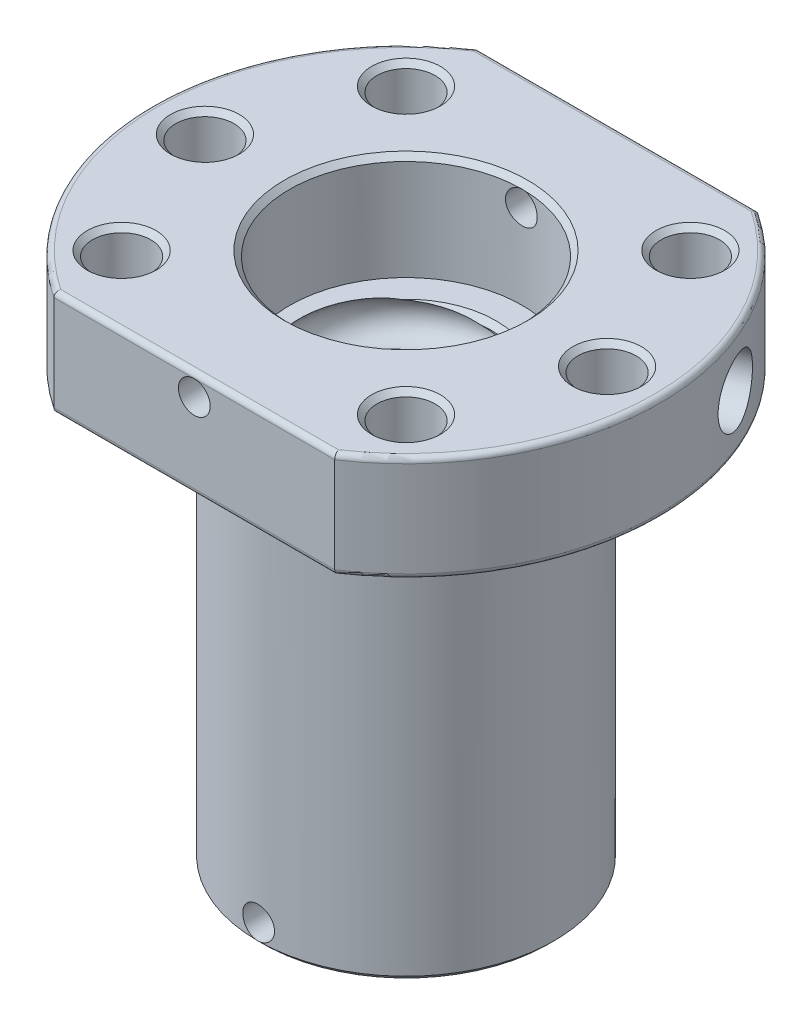
from build123d import *

# Parameters (mm, degrees)
CUT_EXTRUDE2_REACH      = 62.432
CUT_EXTRUDE3_REACH      = 60.958
SKETCH4_R               = 2.75
CHAMFER1_SIZE           = 0.5
CUT_EXTRUDE4_REACH      = 76.052
CUT_EXTRUDE4_END_RADIUS = 11
SKETCH5_R               = 2.5
SKETCH6_R               = 3
CUT_EXTRUDE5_DEPTH      = 10
FILLET1_R               = 0.5
SKETCH7_R               = 1.5
CUT_EXTRUDE6_DEPTH      = 69.381284083
SKETCH8_R               = 1.5
CUT_EXTRUDE7_DEPTH      = 28
CUT_SWEEP1_PITCH        = 5


with BuildPart() as part:
    # Sketch1 → Revolve1 (revolve)
    with BuildSketch(Plane(origin=(0, 0, 0), x_dir=(0, 0, -1), z_dir=(1, 0, 0))):
        Polygon((-11, 0), (-24, 0), (-24, -10), (-14, -10), (-14, -50), (-11, -50), (-11, -40), (-8, -40), (-8, -10), (-11, -10), align=None)
    revolve(axis=Axis((0, 0, 0), (0, -1, 0)))

    # Sketch2 → Cut-Extrude2 (cut, up to next)
    with BuildSketch(Plane(origin=(0, 0, 0), x_dir=(1, 0, 0), z_dir=(0, 1, 0)), mode=Mode.PRIVATE) as cut_extrude2_sk1:
        with BuildLine():
            Line((-13.266499161, 20), (13.266499161, 20))
            ThreePointArc((13.266499161, 20), (0, 24), (-13.266499161, 20))
        make_face()
    cut_extrude2_tool1 = extrude(cut_extrude2_sk1.sketch, amount=-CUT_EXTRUDE2_REACH, mode=Mode.PRIVATE) & part.part
    # Sketch2 → Cut-Extrude2 (cut, up to next)
    with BuildSketch(Plane(origin=(0, 0, 0), x_dir=(1, 0, 0), z_dir=(0, 1, 0)), mode=Mode.PRIVATE) as cut_extrude2_sk2:
        with BuildLine():
            Line((-13.266499161, -20), (13.266499161, -20))
            ThreePointArc((13.266499161, -20), (0, -24), (-13.266499161, -20))
        make_face()
    cut_extrude2_tool2 = extrude(cut_extrude2_sk2.sketch, amount=-CUT_EXTRUDE2_REACH, mode=Mode.PRIVATE) & part.part
    add(cut_extrude2_tool1.solids().sort_by_distance((0, 0, -21.612009))[0], mode=Mode.SUBTRACT)
    add(cut_extrude2_tool2.solids().sort_by_distance((0, 0, 21.612009))[0], mode=Mode.SUBTRACT)

    # Sketch4 → Cut-Extrude3 (cut, up to next)
    with BuildSketch(Plane(origin=(0, 0, 0), x_dir=(1, 0, 0), z_dir=(0, 1, 0)), mode=Mode.PRIVATE) as cut_extrude3_sk1:
        with Locations(Location((-19, 0, 0), (0, 0, 270))):
            Circle(SKETCH4_R)
    cut_extrude3_tool1 = extrude(cut_extrude3_sk1.sketch, amount=-CUT_EXTRUDE3_REACH, mode=Mode.PRIVATE) & part.part
    # Sketch4 → Cut-Extrude3 (cut, up to next)
    with BuildSketch(Plane(origin=(0, 0, 0), x_dir=(1, 0, 0), z_dir=(0, 1, 0)), mode=Mode.PRIVATE) as cut_extrude3_sk2:
        with Locations(Location((-13.435028843, -13.435028843, 0), (0, 0, 270))):
            Circle(SKETCH4_R)
    cut_extrude3_tool2 = extrude(cut_extrude3_sk2.sketch, amount=-CUT_EXTRUDE3_REACH, mode=Mode.PRIVATE) & part.part
    # Sketch4 → Cut-Extrude3 (cut, up to next)
    with BuildSketch(Plane(origin=(0, 0, 0), x_dir=(1, 0, 0), z_dir=(0, 1, 0)), mode=Mode.PRIVATE) as cut_extrude3_sk3:
        with Locations(Location((-13.435028843, 13.435028843, 0), (0, 0, 90))):
            Circle(SKETCH4_R)
    cut_extrude3_tool3 = extrude(cut_extrude3_sk3.sketch, amount=-CUT_EXTRUDE3_REACH, mode=Mode.PRIVATE) & part.part
    # Sketch4 → Cut-Extrude3 (cut, up to next)
    with BuildSketch(Plane(origin=(0, 0, 0), x_dir=(1, 0, 0), z_dir=(0, 1, 0)), mode=Mode.PRIVATE) as cut_extrude3_sk4:
        with Locations(Location((13.435028843, -13.435028843, 0), (0, 0, 90))):
            Circle(SKETCH4_R)
    cut_extrude3_tool4 = extrude(cut_extrude3_sk4.sketch, amount=-CUT_EXTRUDE3_REACH, mode=Mode.PRIVATE) & part.part
    # Sketch4 → Cut-Extrude3 (cut, up to next)
    with BuildSketch(Plane(origin=(0, 0, 0), x_dir=(1, 0, 0), z_dir=(0, 1, 0)), mode=Mode.PRIVATE) as cut_extrude3_sk5:
        with Locations(Location((19, 0, 0), (0, 0, 90))):
            Circle(SKETCH4_R)
    cut_extrude3_tool5 = extrude(cut_extrude3_sk5.sketch, amount=-CUT_EXTRUDE3_REACH, mode=Mode.PRIVATE) & part.part
    # Sketch4 → Cut-Extrude3 (cut, up to next)
    with BuildSketch(Plane(origin=(0, 0, 0), x_dir=(1, 0, 0), z_dir=(0, 1, 0)), mode=Mode.PRIVATE) as cut_extrude3_sk6:
        with Locations(Location((13.435028843, 13.435028843, 0), (0, 0, 270))):
            Circle(SKETCH4_R)
    cut_extrude3_tool6 = extrude(cut_extrude3_sk6.sketch, amount=-CUT_EXTRUDE3_REACH, mode=Mode.PRIVATE) & part.part
    add(cut_extrude3_tool1.solids().sort_by_distance((-19, 0, 0))[0], mode=Mode.SUBTRACT)
    add(cut_extrude3_tool2.solids().sort_by_distance((-13.435029, 0, 13.435029))[0], mode=Mode.SUBTRACT)
    add(cut_extrude3_tool3.solids().sort_by_distance((-13.435029, 0, -13.435029))[0], mode=Mode.SUBTRACT)
    add(cut_extrude3_tool4.solids().sort_by_distance((13.435029, 0, 13.435029))[0], mode=Mode.SUBTRACT)
    add(cut_extrude3_tool5.solids().sort_by_distance((19, 0, 0))[0], mode=Mode.SUBTRACT)
    add(cut_extrude3_tool6.solids().sort_by_distance((13.435029, 0, -13.435029))[0], mode=Mode.SUBTRACT)

    # Chamfer1
    chamfer1_edges = [part.edges().sort_by_distance(p)[0] for p in [
        (0, -50, -14),
        (-19, -10, -2.75),
        (-19, 0, -2.75),
        (-13.435028843, -10, 10.685028843),
        (-13.435028843, 0, 10.685028843),
        (-13.435028843, -10, -10.685028843),
        (-13.435028843, 0, -10.685028843),
        (13.435028843, -10, 16.185028843),
        (13.435028843, 0, 16.185028843),
        (19, -10, 2.75),
        (19, 0, 2.75),
        (13.435028843, -10, -16.185028843),
        (13.435028843, 0, -16.185028843),
        (0, 0, -11),
        (0, -10, -8),
        (0, -40, -8),
        (0, -50, -11),
    ]]
    chamfer(chamfer1_edges, length=CHAMFER1_SIZE)

    # Cut-Extrude4: up to this cylinder (the profile starts outside it)
    cut_extrude4_end = Plane(origin=(0, -5.000195, 0), z_dir=(0, 1, 0)) * Cylinder(CUT_EXTRUDE4_END_RADIUS, 175.104, mode=Mode.PRIVATE)
    # Sketch5 → Cut-Extrude4 (cut, up to the surface)
    with BuildSketch(Plane(origin=(22.17310878, 0, -9.184402377), x_dir=(-0.38268343236508734, 0, -0.9238795325112877), z_dir=(0.9238795325112877, 0, -0.38268343236508734)), mode=Mode.PRIVATE) as cut_extrude4_sk1:
        with Locations((0, -5.000195071)):
            Circle(SKETCH5_R)
    cut_extrude4_tool1 = extrude(cut_extrude4_sk1.sketch, amount=-CUT_EXTRUDE4_REACH, mode=Mode.PRIVATE) - cut_extrude4_end
    add(cut_extrude4_tool1.solids().sort_by_distance((22.173109, -5.000195, -9.184402))[0], mode=Mode.SUBTRACT)

    # Sketch6 → Cut-Extrude5 (cut)
    with BuildSketch(Plane(origin=(22.17310878, 0, -9.184402377), x_dir=(-0.38268343236508734, 0, -0.9238795325112877), z_dir=(0.9238795325112877, 0, -0.38268343236508734))):
        with Locations((0, -5.000195071)):
            Circle(SKETCH6_R)
    extrude(amount=-CUT_EXTRUDE5_DEPTH, mode=Mode.SUBTRACT)

    # Fillet1
    fillet1_edges = [part.edges().sort_by_distance(p)[0] for p in [
        (0, -10, -14),
        (24, -10, 0),
        (0, -10, 20),
        (0, 0, 20),
        (-24, 0, 0),
        (-24, -10, 0),
        (0, -10, -20),
        (0, 0, -20),
        (24, 0, 0),
    ]]
    fillet(fillet1_edges, radius=FILLET1_R)

    # Sketch7 → Cut-Extrude6 (cut, through all)
    with BuildSketch(Plane.XY.offset(20)):
        with Locations(Location((0, -2, 0), (0, 0, 90))):
            Circle(SKETCH7_R)
    extrude(amount=-CUT_EXTRUDE6_DEPTH, mode=Mode.SUBTRACT)

    # Sketch8 → Cut-Extrude7 (cut)
    with BuildSketch(Plane.XY.offset(14)):
        with Locations(Location((0, -48, 0), (0, 0, 270))):
            Circle(SKETCH8_R)
    extrude(amount=-CUT_EXTRUDE7_DEPTH, mode=Mode.SUBTRACT)

    # Cut-Sweep1: the profile of Sketch10 screwed along a right-hand helix of 10 turns, 12 arcs to a turn; built about Z, then put on its axis
    cut_sweep1_z = Axis((0, 0, 0), (0, 0, 1))
    cut_sweep1_corners = [(6.1, 0, 0), (8, 0, -1.9), (9.9, 0, 0), (8, 0, 1.9)]
    with BuildLine(mode=Mode.PRIVATE) as cut_sweep1_profile:
        ThreePointArc((6.1, 0, 0), (6.656497116, 0, -1.343502884), (8, 0, -1.9))
        ThreePointArc((8, 0, -1.9), (9.343502884, 0, -1.343502884), (9.9, 0, 0))
        ThreePointArc((9.9, 0, 0), (9.343502884, 0, 1.343502884), (8, 0, 1.9))
        ThreePointArc((8, 0, 1.9), (6.656497116, 0, 1.343502884), (6.1, 0, 0))
    cut_sweep1_cap = Face(cut_sweep1_profile.wire())
    cut_sweep1_arcs = [((6.1, 0, 0), (6.1, 0, -1.9), (8, 0, -1.9), (1, 0.7071067811865476, 1)), ((8, 0, -1.9), (9.9, 0, -1.9), (9.9, 0, 0), (1, 0.7071067811865476, 1)), ((9.9, 0, 0), (9.9, 0, 1.9), (8, 0, 1.9), (1, 0.7071067811865476, 1)), ((8, 0, 1.9), (6.1, 0, 1.9), (6.1, 0, 0), (1, 0.7071067811865476, 1))]  # start, shoulder, end, weights
    cut_sweep1_turn_angles = [0, 15, 30, 45, 60, 75, 90, 105, 120, 135, 150, 165, 180, 195, 210, 225, 240, 255, 270, 285, 300, 315, 330, 345, 360]
    cut_sweep1_turn_weights = [1, 0.9659258262890683, 1, 0.9659258262890683, 1, 0.9659258262890683, 1, 0.9659258262890683, 1, 0.9659258262890683, 1, 0.9659258262890683, 1, 0.9659258262890683, 1, 0.9659258262890683, 1, 0.9659258262890683, 1, 0.9659258262890683, 1, 0.9659258262890683, 1, 0.9659258262890683, 1]
    cut_sweep1_turn_sides = [Face.make_bezier_surface([[Vector(p[j][0], p[j][1], 0).rotate(cut_sweep1_z, cut_sweep1_turn_angles[2 * i + k]) / cut_sweep1_turn_weights[2 * i + k] + Vector(0, 0, p[j][2] + CUT_SWEEP1_PITCH * cut_sweep1_turn_angles[2 * i + k] / 360) for k in range(3)] for j in range(3)], [[p[3][j] * cut_sweep1_turn_weights[2 * i + k] for k in range(3)] for j in range(3)]) for p in cut_sweep1_arcs for i in range(12)]
    cut_sweep1 = Plane(origin=(0, 0, 0), x_dir=(0, 0, 1), z_dir=(0, -1, 0)) * Solid(Shell([*[p.moved(Location((0, 0, CUT_SWEEP1_PITCH * i))) for i in range(10) for p in cut_sweep1_turn_sides], cut_sweep1_cap, cut_sweep1_cap.rotate(cut_sweep1_z, 3600).moved(Location((0, 0, CUT_SWEEP1_PITCH * 3600 / 360)))]))
    add(cut_sweep1, mode=Mode.SUBTRACT)


solid = part.part
